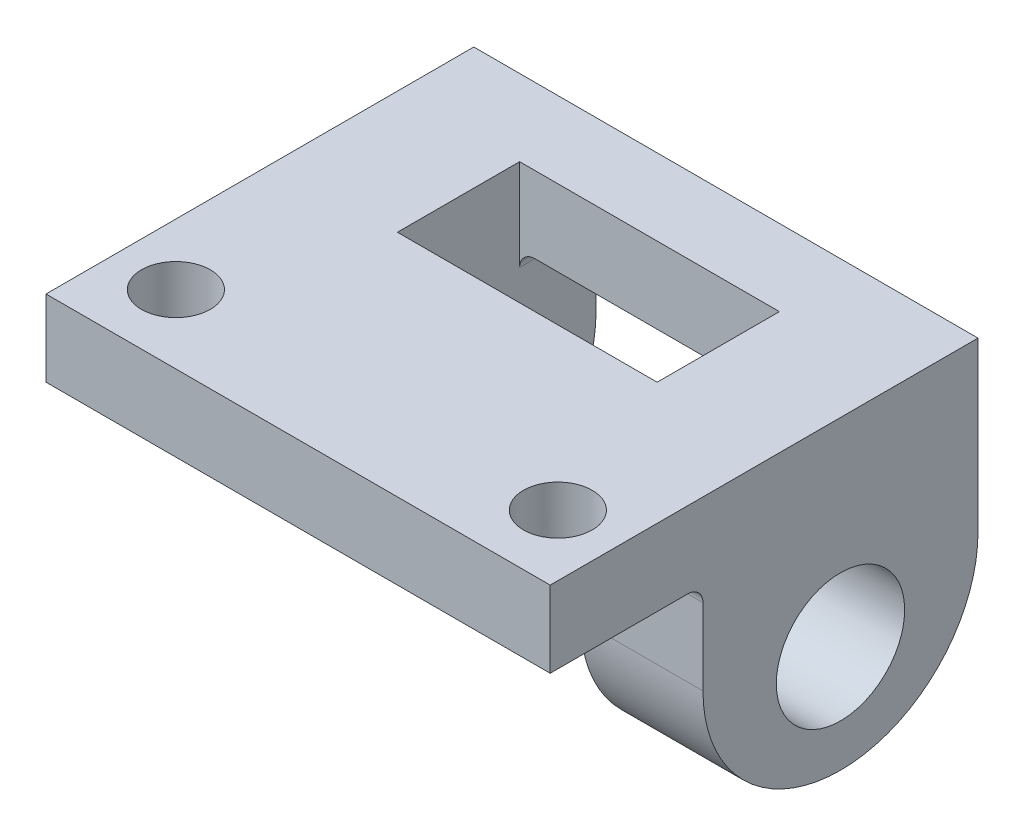
from build123d import *

# Parameters (mm, degrees)
SKETCH_1_W          = 33
SKETCH_1_H          = 28
SKETCH_1_W_2        = 17
SKETCH_1_H_2        = 8
EXTRUDE_1_DEPTH     = 5
SKETCH_2_W          = 8
SKETCH_2_H          = 18
EXTRUDE_2_DEPTH     = 15
SKETCH_3_R          = 4.2
CUT_EXTRUDE_1_DEPTH = 37
FILLET_1_R          = 9
FILLET_2_R          = 1
SKETCH_4_R          = 2.25
CUT_EXTRUDE_2_DEPTH = 37


with BuildPart() as part:
    # 草图1 → 凸台-拉伸1 (new body)
    with BuildSketch(Plane(origin=(0, 0, 0), x_dir=(1, 0, 0), z_dir=(0, 1, 0))):
        with Locations((0, -5)):
            Rectangle(SKETCH_1_W, SKETCH_1_H)
        Rectangle(SKETCH_1_W_2, SKETCH_1_H_2, mode=Mode.SUBTRACT)
    extrude(amount=EXTRUDE_1_DEPTH)

    # 草图2 → 凸台-拉伸2 (add)
    with BuildSketch(Plane.XZ):
        with Locations((-12.5, 0)):
            Rectangle(SKETCH_2_W, SKETCH_2_H)
        with Locations((12.5, 0)):
            Rectangle(SKETCH_2_W, SKETCH_2_H)
    extrude(amount=EXTRUDE_2_DEPTH)

    # 草图3 → 切除-拉伸1 (cut)
    with BuildSketch(Plane.ZY.offset(16.5)):
        with Locations((0, -8)):
            Circle(SKETCH_3_R)
    extrude(amount=-CUT_EXTRUDE_1_DEPTH, mode=Mode.SUBTRACT)

    # 圆角1
    fillet_1_edges = [part.edges().sort_by_distance(p)[0] for p in [
        (12.5, -15, -9),
        (12.5, -15, 9),
        (-12.5, -15, 9),
        (-12.5, -15, -9),
    ]]
    fillet(fillet_1_edges, radius=FILLET_1_R - 0.0001)  # a hair under: the kernel refuses the full size

    # 圆角2
    fillet_2_edges = [part.edges().sort_by_distance(p)[0] for p in [
        (-8.5, 0, 6.5),
        (-8.5, 0, -6.5),
        (-12.5, 0, 9),
        (12.5, 0, 9),
        (8.5, 0, 6.5),
        (8.5, 0, -6.5),
    ]]
    fillet(fillet_2_edges, radius=FILLET_2_R)

    # 草图4 → 切除-拉伸2 (cut)
    with BuildSketch(Plane.XZ):
        with Locations(Location((-12.5, 14.5, 0), (0, 0, 270))):
            Circle(SKETCH_4_R)
        with Locations(Location((12.5, 14.5, 0), (0, 0, 270))):
            Circle(SKETCH_4_R)
    extrude(amount=-CUT_EXTRUDE_2_DEPTH, mode=Mode.SUBTRACT)


solid = part.part
